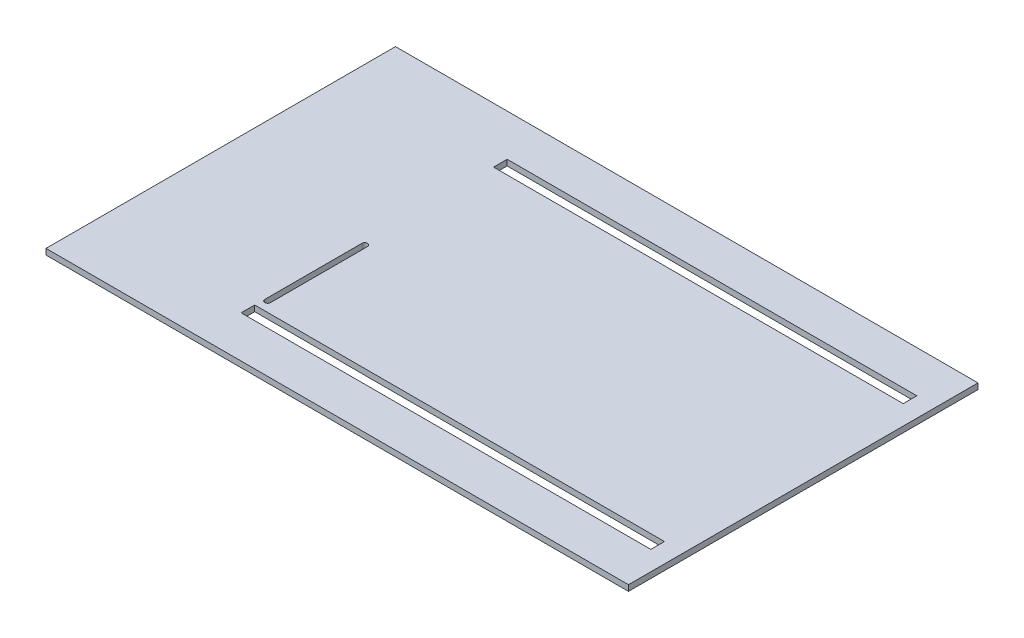
from build123d import *

# Parameters (mm, degrees)
SKETCH_1_W          = 300
SKETCH_1_H          = 180
EXTRUDE_1_DEPTH     = 3
CUT_EXTRUDE_1_DEPTH = 10
SKETCH_3_R          = 1.45
CUT_EXTRUDE_2_DEPTH = 10
SKETCH_4_W          = 211
SKETCH_4_H          = 7
CUT_EXTRUDE_3_DEPTH = 10


with BuildPart() as part:
    # 스케치1 → 보스-돌출1 (new body)
    with BuildSketch(Plane(origin=(0, 0, 0), x_dir=(1, 0, 0), z_dir=(0, 1, 0))):
        with Locations((150, 90)):
            Rectangle(SKETCH_1_W, SKETCH_1_H)
    extrude(amount=EXTRUDE_1_DEPTH)

    # 스케치2 → 컷-돌출1 (cut)
    with BuildSketch(Plane(origin=(0, 3, 0), x_dir=(1, 0, 0), z_dir=(0, 1, 0))):
        Polygon((79.1, 58.606579113), (79.1, 83.606579113), (82, 83.606579113), (82, 33.606579113), (79.1, 33.606579113), align=None)
    extrude(amount=-CUT_EXTRUDE_1_DEPTH, mode=Mode.SUBTRACT)

    # 스케치3 → 컷-돌출2 (cut)
    with BuildSketch(Plane(origin=(0, 3, 0), x_dir=(1, 0, 0), z_dir=(0, 1, 0))):
        with Locations((80.55, 83.606579113)):
            Circle(SKETCH_3_R)
        with Locations((80.55, 33.606579113)):
            Circle(SKETCH_3_R)
    extrude(amount=-CUT_EXTRUDE_2_DEPTH, mode=Mode.SUBTRACT)

    # 스케치4 → 컷-돌출3 (cut)
    with BuildSketch(Plane(origin=(0, 3, 0), x_dir=(1, 0, 0), z_dir=(0, 1, 0))):
        with Locations((184.5, 155)):
            Rectangle(SKETCH_4_W, SKETCH_4_H)
        with Locations((184.5, 25)):
            Rectangle(SKETCH_4_W, SKETCH_4_H)
    extrude(amount=-CUT_EXTRUDE_3_DEPTH, mode=Mode.SUBTRACT)


solid = part.part
